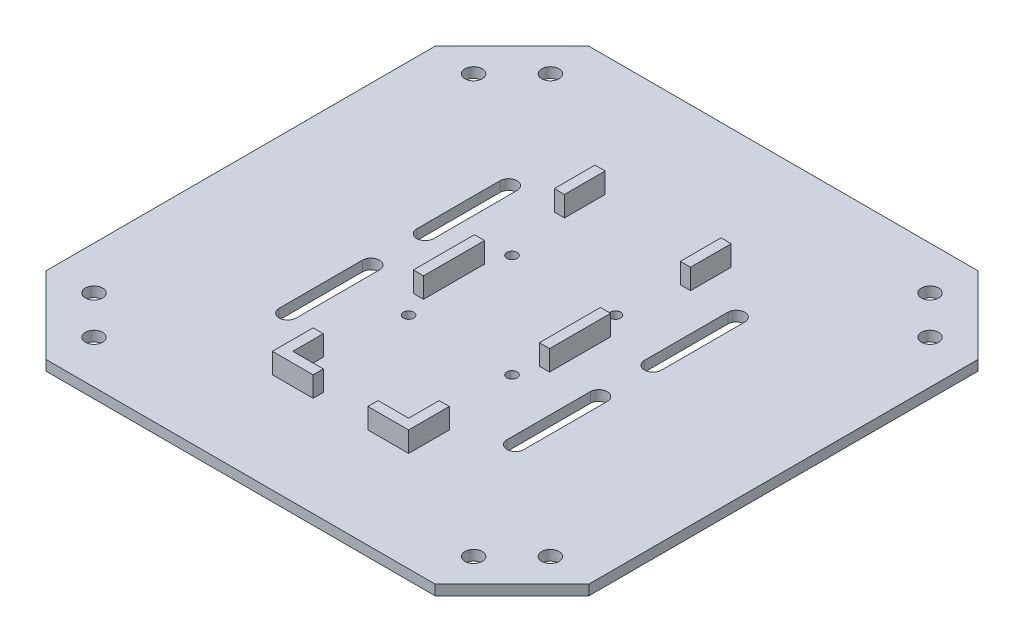
from build123d import *

# Parameters (mm, degrees)
SKETCH1_W                                  = 160
SKETCH1_H                                  = 160
BOSS_EXTRUDE1_DEPTH                        = 3
CUT_EXTRUDE2_REACH                         = 115.177
CUT_EXTRUDE1_REACH                         = 115.177
SKETCH2_R                                  = 2.55
MIRROR2_AT_THE_SECOND_PLANE_COPY_1_REACH   = 115.177
MIRROR2_AT_THE_SECOND_PLANE_COPY_2_REACH   = 115.177
MIRROR2_AT_THE_SECOND_PLANE_COPY_2_SKETC_R = 2.55
CUT_EXTRUDE3_REACH                         = 115.177
SKETCH11_R                                 = 1.525
SKETCH12_W                                 = 3
SKETCH12_H                                 = 12
SKETCH12_H_2                               = 18
BOSS_EXTRUDE2_DEPTH                        = 6
CUT_EXTRUDE4_REACH                         = 115.296
MIRROR4_AT_THE_SECOND_PLANE_COPY_1_REACH   = 115.296


with BuildPart() as part:
    # Sketch1 → Boss-Extrude1 (new body)
    with BuildSketch(Plane(origin=(0, 0, 0), x_dir=(1, 0, 0), z_dir=(0, 1, 0))):
        Rectangle(SKETCH1_W, SKETCH1_H)
    extrude(amount=-BOSS_EXTRUDE1_DEPTH)

    # Sketch6 → Cut-Extrude2 (cut, up to next)
    with BuildSketch(Plane(origin=(0, 0, 0), x_dir=(1, 0, 0), z_dir=(0, 1, 0)), mode=Mode.PRIVATE) as cut_extrude2_sk1:
        Polygon((-80, -57.372583002), (-57.372583002, -80), (-80, -80), align=None)
    cut_extrude2_tool1 = extrude(cut_extrude2_sk1.sketch, amount=-CUT_EXTRUDE2_REACH, mode=Mode.PRIVATE) & part.part
    cut_extrude2 = cut_extrude2_tool1.solids().sort_by_distance((-72.457528, 0, 72.457528))[0]
    add(cut_extrude2, mode=Mode.SUBTRACT)

    # Sketch2 → Cut-Extrude1 (cut, up to next)
    with BuildSketch(Plane(origin=(0, 0, 0), x_dir=(1, 0, 0), z_dir=(0, 1, 0)), mode=Mode.PRIVATE) as cut_extrude1_sk1:
        with Locations((-67.272077939, -55.95836944)):
            Circle(SKETCH2_R)
    cut_extrude1_tool1 = extrude(cut_extrude1_sk1.sketch, amount=-CUT_EXTRUDE1_REACH, mode=Mode.PRIVATE) & part.part
    # Sketch2 → Cut-Extrude1 (cut, up to next)
    with BuildSketch(Plane(origin=(0, 0, 0), x_dir=(1, 0, 0), z_dir=(0, 1, 0)), mode=Mode.PRIVATE) as cut_extrude1_sk2:
        with Locations((-55.95836944, -67.272077939)):
            Circle(SKETCH2_R)
    cut_extrude1_tool2 = extrude(cut_extrude1_sk2.sketch, amount=-CUT_EXTRUDE1_REACH, mode=Mode.PRIVATE) & part.part
    cut_extrude1_1 = cut_extrude1_tool1.solids().sort_by_distance((-67.272078, 0, 55.958369))[0]
    add(cut_extrude1_1, mode=Mode.SUBTRACT)
    cut_extrude1_2 = cut_extrude1_tool2.solids().sort_by_distance((-55.958369, 0, 67.272078))[0]
    add(cut_extrude1_2, mode=Mode.SUBTRACT)
    cut_extrude1 = cut_extrude1_1 + cut_extrude1_2  # Cut-Extrude1 as one shape, for the pattern or mirror that repeats it

    # Mirror2: Cut-Extrude2, Cut-Extrude1 across plane
    add(cut_extrude2.mirror(Plane(origin=(0, 0, 0), x_dir=(0, 0, 1), z_dir=(1, 0, 0))), mode=Mode.SUBTRACT)
    add(cut_extrude1.mirror(Plane(origin=(0, 0, 0), x_dir=(0, 0, 1), z_dir=(1, 0, 0))), mode=Mode.SUBTRACT)

    # Mirror2 at the second plane: Cut-Extrude2, Cut-Extrude1 across plane
    add(cut_extrude2.mirror(Plane.XY), mode=Mode.SUBTRACT)
    add(cut_extrude1.mirror(Plane.XY), mode=Mode.SUBTRACT)

    # Mirror2 at the second plane copy 1 sketc → Mirror2 at the second plane copy 1 (cut, up to next)
    with BuildSketch(Plane(origin=(0, 0, 0), x_dir=(-1, 0, 0), z_dir=(0, 1, 0)), mode=Mode.PRIVATE) as mirror2_at_the_second_plane_copy_1_sk1:
        Polygon((-80, -57.372583002), (-57.372583002, -80), (-80, -80), align=None)
    mirror2_at_the_second_plane_copy_1_tool1 = extrude(mirror2_at_the_second_plane_copy_1_sk1.sketch, amount=-MIRROR2_AT_THE_SECOND_PLANE_COPY_1_REACH, mode=Mode.PRIVATE) & part.part
    add(mirror2_at_the_second_plane_copy_1_tool1.solids().sort_by_distance((72.457528, 0, -72.457528))[0], mode=Mode.SUBTRACT)

    # Mirror2 at the second plane copy 2 sketc → Mirror2 at the second plane copy 2 (cut, up to next)
    with BuildSketch(Plane(origin=(0, 0, 0), x_dir=(-1, 0, 0), z_dir=(0, 1, 0)), mode=Mode.PRIVATE) as mirror2_at_the_second_plane_copy_2_sk1:
        with Locations((-67.272077939, -55.95836944)):
            Circle(MIRROR2_AT_THE_SECOND_PLANE_COPY_2_SKETC_R)
    mirror2_at_the_second_plane_copy_2_tool1 = extrude(mirror2_at_the_second_plane_copy_2_sk1.sketch, amount=-MIRROR2_AT_THE_SECOND_PLANE_COPY_2_REACH, mode=Mode.PRIVATE) & part.part
    # Mirror2 at the second plane copy 2 sketc → Mirror2 at the second plane copy 2 (cut, up to next)
    with BuildSketch(Plane(origin=(0, 0, 0), x_dir=(-1, 0, 0), z_dir=(0, 1, 0)), mode=Mode.PRIVATE) as mirror2_at_the_second_plane_copy_2_sk2:
        with Locations((-55.95836944, -67.272077939)):
            Circle(MIRROR2_AT_THE_SECOND_PLANE_COPY_2_SKETC_R)
    mirror2_at_the_second_plane_copy_2_tool2 = extrude(mirror2_at_the_second_plane_copy_2_sk2.sketch, amount=-MIRROR2_AT_THE_SECOND_PLANE_COPY_2_REACH, mode=Mode.PRIVATE) & part.part
    add(mirror2_at_the_second_plane_copy_2_tool1.solids().sort_by_distance((67.272078, 0, -55.958369))[0], mode=Mode.SUBTRACT)
    add(mirror2_at_the_second_plane_copy_2_tool2.solids().sort_by_distance((55.958369, 0, -67.272078))[0], mode=Mode.SUBTRACT)

    # Sketch11 → Cut-Extrude3 (cut, up to next)
    with BuildSketch(Plane(origin=(0, 0, 0), x_dir=(1, 0, 0), z_dir=(0, 1, 0)), mode=Mode.PRIVATE) as cut_extrude3_sk1:
        with Locations((-15.25, 15.25)):
            Circle(SKETCH11_R)
    cut_extrude3_tool1 = extrude(cut_extrude3_sk1.sketch, amount=-CUT_EXTRUDE3_REACH, mode=Mode.PRIVATE) & part.part
    # Sketch11 → Cut-Extrude3 (cut, up to next)
    with BuildSketch(Plane(origin=(0, 0, 0), x_dir=(1, 0, 0), z_dir=(0, 1, 0)), mode=Mode.PRIVATE) as cut_extrude3_sk2:
        with Locations((15.25, 15.25)):
            Circle(SKETCH11_R)
    cut_extrude3_tool2 = extrude(cut_extrude3_sk2.sketch, amount=-CUT_EXTRUDE3_REACH, mode=Mode.PRIVATE) & part.part
    # Sketch11 → Cut-Extrude3 (cut, up to next)
    with BuildSketch(Plane(origin=(0, 0, 0), x_dir=(1, 0, 0), z_dir=(0, 1, 0)), mode=Mode.PRIVATE) as cut_extrude3_sk3:
        with Locations((15.25, -15.25)):
            Circle(SKETCH11_R)
    cut_extrude3_tool3 = extrude(cut_extrude3_sk3.sketch, amount=-CUT_EXTRUDE3_REACH, mode=Mode.PRIVATE) & part.part
    # Sketch11 → Cut-Extrude3 (cut, up to next)
    with BuildSketch(Plane(origin=(0, 0, 0), x_dir=(1, 0, 0), z_dir=(0, 1, 0)), mode=Mode.PRIVATE) as cut_extrude3_sk4:
        with Locations((-15.25, -15.25)):
            Circle(SKETCH11_R)
    cut_extrude3_tool4 = extrude(cut_extrude3_sk4.sketch, amount=-CUT_EXTRUDE3_REACH, mode=Mode.PRIVATE) & part.part
    add(cut_extrude3_tool1.solids().sort_by_distance((-15.25, 0, -15.25))[0], mode=Mode.SUBTRACT)
    add(cut_extrude3_tool2.solids().sort_by_distance((15.25, 0, -15.25))[0], mode=Mode.SUBTRACT)
    add(cut_extrude3_tool3.solids().sort_by_distance((15.25, 0, 15.25))[0], mode=Mode.SUBTRACT)
    add(cut_extrude3_tool4.solids().sort_by_distance((-15.25, 0, 15.25))[0], mode=Mode.SUBTRACT)

    # Sketch12 → Boss-Extrude2 (add)
    with BuildSketch(Plane(origin=(0, 0, 0), x_dir=(1, 0, 0), z_dir=(0, 1, 0))):
        Polygon((-17.075, -47.55), (-8.075, -47.55), (-8.075, -50.55), (-20.075, -50.55), (-20.075, -38.55), (-17.075, -38.55), align=None)
        with Locations((-18.575, 38.55)):
            Rectangle(SKETCH12_W, SKETCH12_H)
        with Locations((-18.575, 0)):
            Rectangle(SKETCH12_W, SKETCH12_H_2)
    boss_extrude2 = extrude(amount=BOSS_EXTRUDE2_DEPTH)

    # Mirror3: Boss-Extrude2 across plane
    add(boss_extrude2.mirror(Plane(origin=(0, 0, 0), x_dir=(0, 0, 1), z_dir=(1, 0, 0))))

    # Sketch13 → Cut-Extrude4 (cut, up to next)
    with BuildSketch(Plane(origin=(0, 0, 0), x_dir=(1, 0, 0), z_dir=(0, 1, 0)), mode=Mode.PRIVATE) as cut_extrude4_sk1:
        with BuildLine():
            Line((-31.075, 32.55), (-31.075, 8))
            ThreePointArc((-31.075, 8), (-33.575, 5.5), (-36.075, 8))
            Line((-36.075, 8), (-36.075, 32.55))
            ThreePointArc((-36.075, 32.55), (-33.575, 35.05), (-31.075, 32.55))
        make_face()
    cut_extrude4_tool1 = extrude(cut_extrude4_sk1.sketch, amount=-CUT_EXTRUDE4_REACH, mode=Mode.PRIVATE) & part.part
    cut_extrude4 = cut_extrude4_tool1.solids().sort_by_distance((-33.575, 0, -20.275))[0]
    add(cut_extrude4, mode=Mode.SUBTRACT)

    # Mirror4: Cut-Extrude4 across plane
    add(cut_extrude4.mirror(Plane(origin=(0, 0, 0), x_dir=(0, 0, 1), z_dir=(1, 0, 0))), mode=Mode.SUBTRACT)

    # Mirror4 at the second plane: Cut-Extrude4 across plane
    add(cut_extrude4.mirror(Plane.XY), mode=Mode.SUBTRACT)

    # Mirror4 at the second plane copy 1 sketc → Mirror4 at the second plane copy 1 (cut, up to next)
    with BuildSketch(Plane(origin=(0, 0, 0), x_dir=(-1, 0, 0), z_dir=(0, 1, 0)), mode=Mode.PRIVATE) as mirror4_at_the_second_plane_copy_1_sk1:
        with BuildLine():
            Line((-31.075, 32.55), (-31.075, 8))
            ThreePointArc((-31.075, 8), (-33.575, 5.5), (-36.075, 8))
            Line((-36.075, 8), (-36.075, 32.55))
            ThreePointArc((-36.075, 32.55), (-33.575, 35.05), (-31.075, 32.55))
        make_face()
    mirror4_at_the_second_plane_copy_1_tool1 = extrude(mirror4_at_the_second_plane_copy_1_sk1.sketch, amount=-MIRROR4_AT_THE_SECOND_PLANE_COPY_1_REACH, mode=Mode.PRIVATE) & part.part
    add(mirror4_at_the_second_plane_copy_1_tool1.solids().sort_by_distance((33.575, 0, 20.275))[0], mode=Mode.SUBTRACT)


solid = part.part
